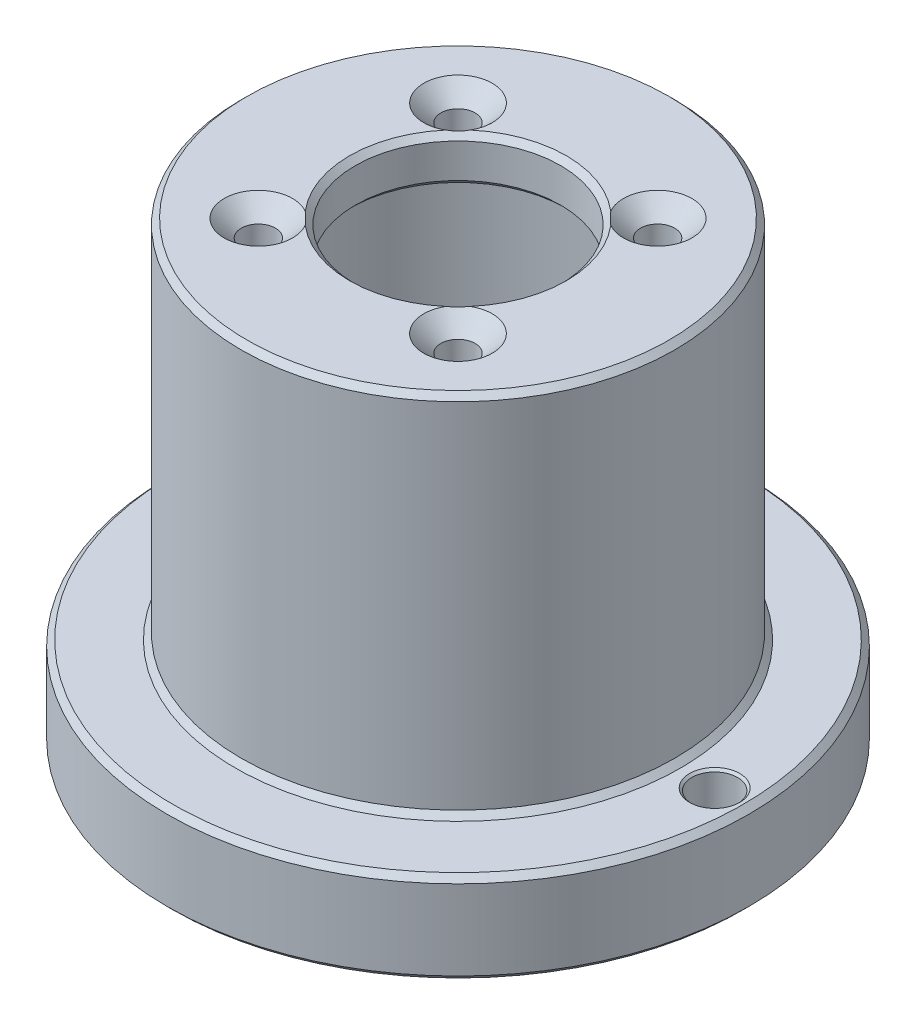
from build123d import *

# Parameters (mm, degrees)
ESQUISSE2_R             = 1.5
ENL_V_MAT_EXTRU_1_DEPTH = 10
CHANFREIN1_SIZE         = 1.5
ESQUISSE3_R             = 2
ENL_V_MAT_EXTRU_2_DEPTH = 10
CHANFREIN2_SIZE         = 0.2
CHANFREIN3_SIZE         = 0.5


with BuildPart() as part:
    # Esquisse1 → Révolution1 (revolve)
    with BuildSketch(Plane.XY, mode=Mode.PRIVATE) as r_volution1_sk:
        Polygon((-15, 0), (-25.5, 0), (-25.5, 8), (-19, 8), (-19, 40), (-9, 40), (-9, 36), (-15, 36), align=None)
    revolve(r_volution1_sk.sketch.rotate(Axis((0, 0, 0), (0, 1, 0)), 270), axis=Axis((0, 0, 0), (0, 1, 0)))

    # Esquisse2 → Enlèv. mat.-Extru.1 (cut)
    with BuildSketch(Plane(origin=(0, 40, 0), x_dir=(1, 0, 0), z_dir=(0, 1, 0))):
        with Locations(Location((-8.75, 8.75, 0), (0, 0, 270))):
            Circle(ESQUISSE2_R)
        with Locations(Location((8.75, 8.75, 0), (0, 0, 270))):
            Circle(ESQUISSE2_R)
        with Locations(Location((8.75, -8.75, 0), (0, 0, 270))):
            Circle(ESQUISSE2_R)
        with Locations(Location((-8.75, -8.75, 0), (0, 0, 270))):
            Circle(ESQUISSE2_R)
    extrude(amount=-ENL_V_MAT_EXTRU_1_DEPTH, mode=Mode.SUBTRACT)

    # Chanfrein1
    chanfrein1_edges = [part.edges().sort_by_distance(p)[0] for p in [
        (-8.75, 40, -10.25),
        (8.75, 40, -10.25),
        (8.75, 40, 7.25),
        (-8.75, 40, 7.25),
    ]]
    chamfer(chanfrein1_edges, length=CHANFREIN1_SIZE)

    # Esquisse3 → Enlèv. mat.-Extru.2 (cut)
    with BuildSketch(Plane(origin=(0, 8, 0), x_dir=(1, 0, 0), z_dir=(0, 1, 0))):
        with Locations(Location((-22.5, 0, 0), (0, 0, 270))):
            Circle(ESQUISSE3_R)
        with Locations(Location((22.5, 0, 0), (0, 0, 270))):
            Circle(ESQUISSE3_R)
    extrude(amount=-ENL_V_MAT_EXTRU_2_DEPTH, mode=Mode.SUBTRACT)

    # Chanfrein2
    chanfrein2_edges = [part.edges().sort_by_distance(p)[0] for p in [
        (-8.75, 36, -10.25),
        (8.75, 36, -10.25),
        (8.75, 36, 7.25),
        (-8.75, 36, 7.25),
        (-22.5, 0, -2),
        (-22.5, 8, -2),
        (22.5, 0, -2),
        (22.5, 8, -2),
    ]]
    chamfer(chanfrein2_edges, length=CHANFREIN2_SIZE)

    # Chanfrein3
    # the kernel refuses this chamfer: 0.5 mm, written as the material it adds along each edge
    with BuildSketch(Plane(origin=(0, 36, 0), x_dir=(0, 0, -1), z_dir=(1, 0, 0))) as chanfrein3_piece_1:
        Polygon((15 - CHANFREIN3_SIZE, 0), (15, -CHANFREIN3_SIZE), (15, 0), align=None)
    revolve(axis=Axis((0, 36, 0), (0, 1, 0)))
    with BuildSketch(Plane(origin=(0, 8, 0), x_dir=(0, 0, -1), z_dir=(1, 0, 0))) as chanfrein3_piece_2:
        Polygon((19, CHANFREIN3_SIZE), (19 + CHANFREIN3_SIZE, 0), (19, 0), align=None)
    revolve(axis=Axis((0, 8, 0), (0, 1, 0)))
    # the kernel refuses this chamfer: 0.5 mm, written as the material it takes off along each edge
    with BuildSketch(Plane(origin=(0, 36, 0), x_dir=(0, 0, -1), z_dir=(1, 0, 0))) as chanfrein3_2_piece_1:
        Polygon((9 + CHANFREIN3_SIZE, 0), (9, CHANFREIN3_SIZE), (9, 0), align=None)
    revolve(axis=Axis((0, 36, 0), (0, 1, 0)), mode=Mode.SUBTRACT)
    with BuildSketch(Plane(origin=(0, 40, 0), x_dir=(0, 0, -1), z_dir=(1, 0, 0))) as chanfrein3_2_piece_2:
        Polygon((9 + CHANFREIN3_SIZE, 0), (9, -CHANFREIN3_SIZE), (9, 0), align=None)
    revolve(axis=Axis((0, 40, 0), (0, 1, 0)), mode=Mode.SUBTRACT)
    with BuildSketch(Plane(origin=(0, 40, 0), x_dir=(0, 0, -1), z_dir=(1, 0, 0))) as chanfrein3_2_piece_3:
        Polygon((19 - CHANFREIN3_SIZE, 0), (19, -CHANFREIN3_SIZE), (19, 0), align=None)
    revolve(axis=Axis((0, 40, 0), (0, 1, 0)), mode=Mode.SUBTRACT)
    with BuildSketch(Plane(origin=(0, 8, 0), x_dir=(0, 0, -1), z_dir=(1, 0, 0))) as chanfrein3_2_piece_4:
        Polygon((25.5 - CHANFREIN3_SIZE, 0), (25.5, -CHANFREIN3_SIZE), (25.5, 0), align=None)
    revolve(axis=Axis((0, 8, 0), (0, 1, 0)), mode=Mode.SUBTRACT)
    with BuildSketch(Plane(origin=(0, 0, 0), x_dir=(0, 0, -1), z_dir=(1, 0, 0))) as chanfrein3_2_piece_5:
        Polygon((25.5 - CHANFREIN3_SIZE, 0), (25.5, CHANFREIN3_SIZE), (25.5, 0), align=None)
    revolve(axis=Axis((0, 0, 0), (0, 1, 0)), mode=Mode.SUBTRACT)
    with BuildSketch(Plane(origin=(0, 0, 0), x_dir=(0, 0, -1), z_dir=(1, 0, 0))) as chanfrein3_2_piece_6:
        Polygon((15, CHANFREIN3_SIZE), (15 + CHANFREIN3_SIZE, 0), (15, 0), align=None)
    revolve(axis=Axis((0, 0, 0), (0, 1, 0)), mode=Mode.SUBTRACT)


solid = part.part
